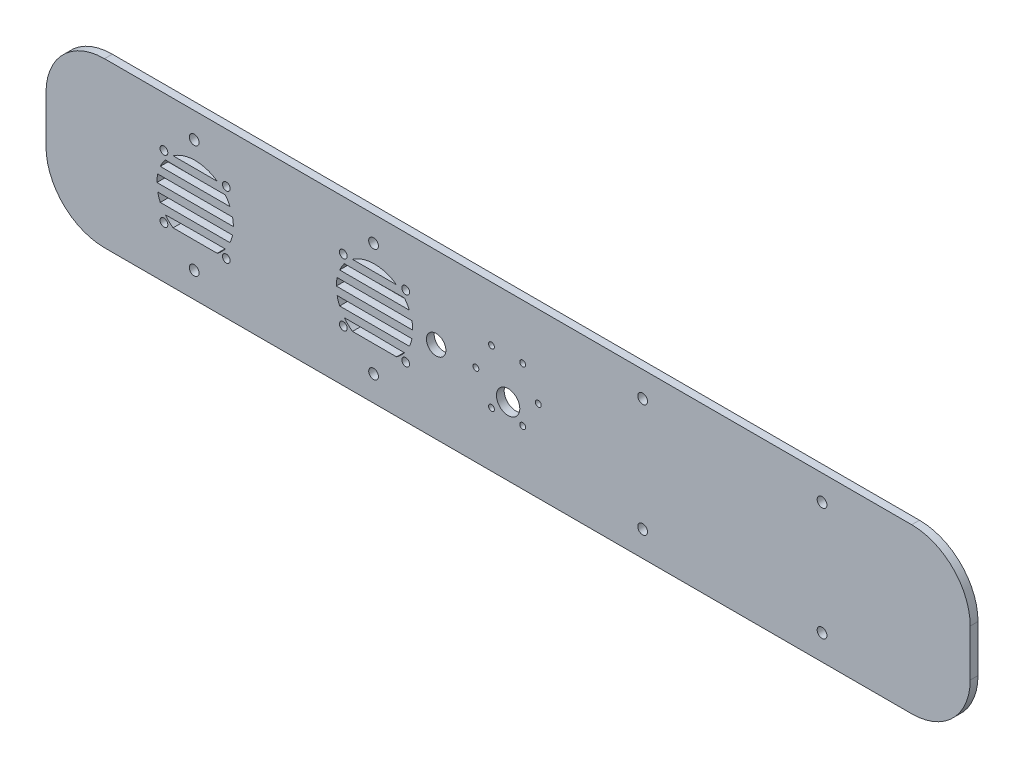
from build123d import *

# Parameters (mm, degrees)
CROQUIS1_R              = 1.5
CROQUIS1_R_2            = 6
SALIENTE_EXTRUIR1_DEPTH = 4
CROQUIS3_R              = 2
CORTAR_EXTRUIR1_DEPTH   = 10
CROQUIS4_R              = 5
CORTAR_EXTRUIR2_DEPTH   = 5
CROQUIS5_R              = 2.5
CORTAR_EXTRUIR3_DEPTH   = 10


with BuildPart() as part:
    # Croquis1 → Saliente-Extruir1 (new body)
    with BuildSketch(Plane.XY):
        with BuildLine():
            Line((207, -38), (-207, -38))
            ThreePointArc((-207, -38), (-228.213203436, -29.213203436), (-237, -8))
            Line((-237, -8), (-237, 16))
            ThreePointArc((-237, 16), (-228.213203436, 37.213203436), (-207, 46))
            Line((-207, 46), (207, 46))
            ThreePointArc((207, 46), (228.213203436, 37.213203436), (237, 16))
            Line((237, 16), (237, -8))
            ThreePointArc((237, -8), (228.213203436, -29.213203436), (207, -38))
        make_face()
        with Locations((15.5, 4)):
            Circle(CROQUIS1_R, mode=Mode.SUBTRACT)
        with Locations((7.496094703, -9.863170633)):
            Circle(CROQUIS1_R, mode=Mode.SUBTRACT)
        with Locations((-8.51171589, -9.863170633)):
            Circle(CROQUIS1_R, mode=Mode.SUBTRACT)
        with Locations((-16.515621187, 4)):
            Circle(CROQUIS1_R, mode=Mode.SUBTRACT)
        with Locations((-8.51171589, 17.863170633)):
            Circle(CROQUIS1_R, mode=Mode.SUBTRACT)
        with Locations((7.496094703, 17.863170633)):
            Circle(CROQUIS1_R, mode=Mode.SUBTRACT)
        with Locations((0, -3)):
            Circle(CROQUIS1_R_2, mode=Mode.SUBTRACT)
    extrude(amount=SALIENTE_EXTRUIR1_DEPTH)

    # Croquis3 → Cortar-Extruir1 (cut)
    with BuildSketch(Plane.XY.offset(4)):
        with Locations((-176.510078636, 20.458426503)):
            Circle(CROQUIS3_R)
        with Locations((-144.510078636, 20.458426503)):
            Circle(CROQUIS3_R)
        with Locations((-176.510078636, -11.541573497)):
            Circle(CROQUIS3_R)
        with Locations((-144.510078636, -11.541573497)):
            Circle(CROQUIS3_R)
        with Locations((-84.510078636, -11.541573497)):
            Circle(CROQUIS3_R)
        with Locations((-52.510078636, -11.541573497)):
            Circle(CROQUIS3_R)
        with Locations((-84.510078636, 20.458426503)):
            Circle(CROQUIS3_R)
        with Locations((-52.510078636, 20.458426503)):
            Circle(CROQUIS3_R)
        with BuildLine():
            Line((-171.81353386, -11.541573497), (-149.206623412, -11.541573497))
            ThreePointArc((-149.206623412, -11.541573497), (-146.967629564, -9.696790667), (-145.025631601, -7.541573497))
            Line((-145.025631601, -7.541573497), (-160.510078636, -7.541573497))
            Line((-160.510078636, -7.541573497), (-175.850570995, -7.725062086))
            ThreePointArc((-175.850570995, -7.725062086), (-173.968028908, -9.777151268), (-171.81353386, -11.541573497))
        make_face()
        with BuildLine():
            Line((-160.510078636, 8.458426503), (-141.332797807, 8.458426503))
            ThreePointArc((-141.332797807, 8.458426503), (-141.023531592, 6.469044388), (-140.920078636, 4.458426503))
            Line((-140.920078636, 4.458426503), (-180.100078636, 4.458426503))
            ThreePointArc((-180.100078636, 4.458426503), (-179.996625681, 6.469044388), (-179.687359465, 8.458426503))
            Line((-179.687359465, 8.458426503), (-160.510078636, 8.458426503))
        make_face()
        with BuildLine():
            Line((-160.510078636, 12.458426503), (-142.628017793, 12.458426503))
            ThreePointArc((-142.628017793, 12.458426503), (-143.707371652, 14.53002707), (-145.025631601, 16.458426503))
            Line((-145.025631601, 16.458426503), (-160.510078636, 16.458426503))
            Line((-160.510078636, 16.458426503), (-175.850570995, 16.641915092))
            ThreePointArc((-175.850570995, 16.641915092), (-177.252536774, 14.629866691), (-178.392139479, 12.458426503))
            Line((-178.392139479, 12.458426503), (-160.510078636, 12.458426503))
        make_face()
        with BuildLine():
            Line((-160.510078636, 0.458426503), (-141.332797807, 0.458426503))
            ThreePointArc((-141.332797807, 0.458426503), (-141.872785343, -1.576422186), (-142.628017793, -3.541573497))
            Line((-142.628017793, -3.541573497), (-160.510078636, -3.541573497))
            Line((-160.510078636, -3.541573497), (-178.392139479, -3.541573497))
            ThreePointArc((-178.392139479, -3.541573497), (-179.147371929, -1.576422186), (-179.687359465, 0.458426503))
            Line((-179.687359465, 0.458426503), (-160.510078636, 0.458426503))
        make_face()
        with BuildLine():
            Line((-171.81353386, 20.458426503), (-149.206623412, 20.458426503))
            ThreePointArc((-149.206623412, 20.458426503), (-160.510078636, 24.048426503), (-171.81353386, 20.458426503))
        make_face()
        with BuildLine():
            Line((-57.206623412, 20.458426503), (-79.81353386, 20.458426503))
            ThreePointArc((-79.81353386, 20.458426503), (-68.510078636, 24.048426503), (-57.206623412, 20.458426503))
        make_face()
        with BuildLine():
            Line((-68.510078636, -7.541573497), (-53.169586278, -7.725062086))
            ThreePointArc((-53.169586278, -7.725062086), (-55.052128364, -9.777151268), (-57.206623412, -11.541573497))
            Line((-57.206623412, -11.541573497), (-79.81353386, -11.541573497))
            ThreePointArc((-79.81353386, -11.541573497), (-82.052527708, -9.696790667), (-83.994525672, -7.541573497))
            Line((-83.994525672, -7.541573497), (-68.510078636, -7.541573497))
        make_face()
        with BuildLine():
            Line((-68.510078636, -3.541573497), (-50.628017793, -3.541573497))
            ThreePointArc((-50.628017793, -3.541573497), (-49.872785343, -1.576422186), (-49.332797807, 0.458426503))
            Line((-49.332797807, 0.458426503), (-68.510078636, 0.458426503))
            Line((-68.510078636, 0.458426503), (-87.687359465, 0.458426503))
            ThreePointArc((-87.687359465, 0.458426503), (-87.147371929, -1.576422186), (-86.392139479, -3.541573497))
            Line((-86.392139479, -3.541573497), (-68.510078636, -3.541573497))
        make_face()
        with BuildLine():
            Line((-68.510078636, 16.458426503), (-53.169586278, 16.641915092))
            ThreePointArc((-53.169586278, 16.641915092), (-51.767620498, 14.629866691), (-50.628017793, 12.458426503))
            Line((-50.628017793, 12.458426503), (-68.510078636, 12.458426503))
            Line((-68.510078636, 12.458426503), (-86.392139479, 12.458426503))
            ThreePointArc((-86.392139479, 12.458426503), (-85.312785621, 14.53002707), (-83.994525672, 16.458426503))
            Line((-83.994525672, 16.458426503), (-68.510078636, 16.458426503))
        make_face()
        with BuildLine():
            Line((-68.510078636, 8.458426503), (-49.332797807, 8.458426503))
            ThreePointArc((-49.332797807, 8.458426503), (-49.023531592, 6.469044388), (-48.920078636, 4.458426503))
            Line((-48.920078636, 4.458426503), (-88.100078636, 4.458426503))
            ThreePointArc((-88.100078636, 4.458426503), (-87.996625681, 6.469044388), (-87.687359465, 8.458426503))
            Line((-87.687359465, 8.458426503), (-68.510078636, 8.458426503))
        make_face()
    extrude(amount=-CORTAR_EXTRUIR1_DEPTH, mode=Mode.SUBTRACT)

    # Croquis4 → Cortar-Extruir2 (cut)
    with BuildSketch(Plane.XY.offset(4)):
        with Locations((-36.9, 4)):
            Circle(CROQUIS4_R)
    extrude(amount=-CORTAR_EXTRUIR2_DEPTH, mode=Mode.SUBTRACT)

    # Croquis5 → Cortar-Extruir3 (cut)
    with BuildSketch(Plane(origin=(0, 0, 0), x_dir=(-1, 0, 0), z_dir=(0, 0, -1))):
        with Locations((69, 33)):
            Circle(CROQUIS5_R)
        with Locations((161, 33)):
            Circle(CROQUIS5_R)
        with Locations((161, -25)):
            Circle(CROQUIS5_R)
        with Locations((69, -25)):
            Circle(CROQUIS5_R)
        with Locations((-69, -25)):
            Circle(CROQUIS5_R)
        with Locations((-161, -25)):
            Circle(CROQUIS5_R)
        with Locations((-161, 33)):
            Circle(CROQUIS5_R)
        with Locations((-69, 33)):
            Circle(CROQUIS5_R)
    extrude(amount=-CORTAR_EXTRUIR3_DEPTH, mode=Mode.SUBTRACT)


solid = part.part
